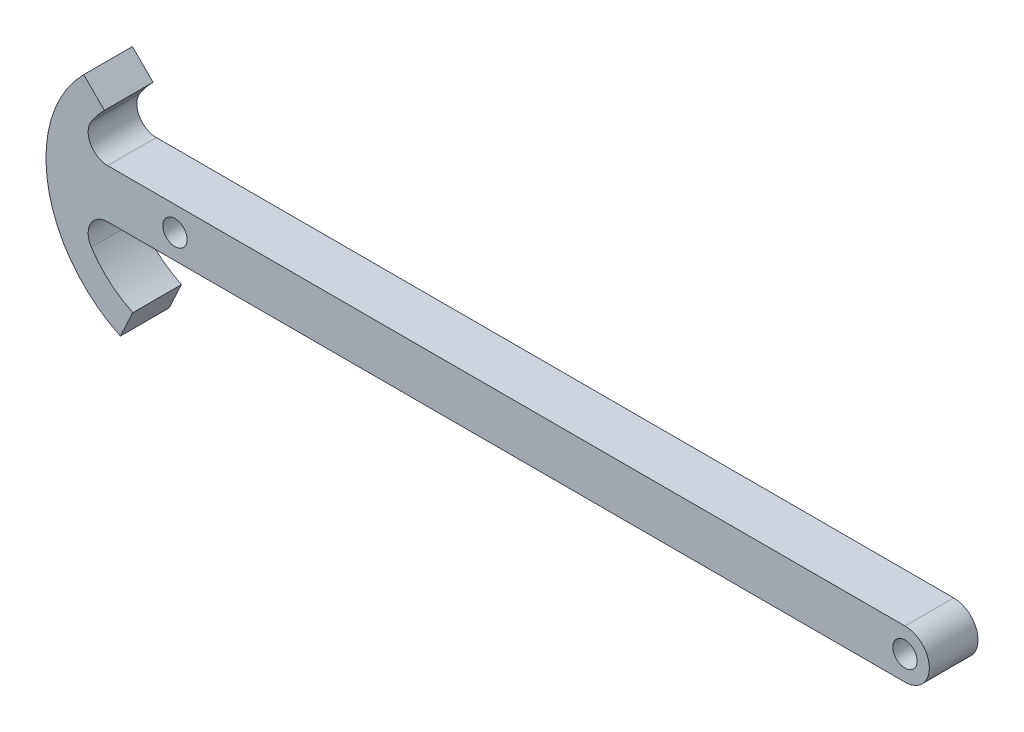
from build123d import *

# Parameters (mm, degrees)
SKETCH1_R                       = 2.5
BOSS_EXTRUDE1_DEPTH             = 5
BOSS_EXTRUDE2_REACH             = 157.161
BOSS_EXTRUDE2_DIRECTION_2_REACH = 157.161
FILLET1_R                       = 4


with BuildPart() as part:
    # Sketch1 → Boss-Extrude1 (new, symmetric)
    with BuildSketch(Plane.XY):
        with BuildLine():
            Line((0, 5), (150, 5))
            ThreePointArc((150, 5), (155, 0), (150, -5))
            Line((150, -5), (0, -5))
            ThreePointArc((0, -5), (-5, 0), (0, 5))
        make_face()
        Circle(SKETCH1_R, mode=Mode.SUBTRACT)
        with Locations((150, 0)):
            Circle(SKETCH1_R, mode=Mode.SUBTRACT)
    extrude(amount=BOSS_EXTRUDE1_DEPTH, both=True)

    # Boss-Extrude2: up to this face of the body (flat: up to its plane)
    boss_extrude2_end = Plane(part.part.faces().sort_by_distance((75, 0, 5))[0])
    # Sketch2 → Boss-Extrude2 (add, up to the picked face)
    with BuildSketch(Plane.XY, mode=Mode.PRIVATE) as boss_extrude2_sk1:
        with BuildLine():
            Line((0, 5), (-19.880895352, 5))
            ThreePointArc((-19.880895352, 5), (-17.831977334, 10.112891988), (-14.495689014, 14.495689014))
            Line((-14.495689014, 14.495689014), (-18.738329701, 18.738329701))
            ThreePointArc((-18.738329701, 18.738329701), (-26.097405455, -4.601676708), (-11.199383936, -24.017156356))
            Line((-11.199383936, -24.017156356), (-8.663674366, -18.579309634))
            ThreePointArc((-8.663674366, -18.579309634), (-15.804984265, -13.055744803), (-19.880895352, -5))
            Line((-19.880895352, -5), (0, -5))
            ThreePointArc((0, -5), (-5, 0), (0, 5))
        make_face()
    boss_extrude2_tool1 = split(extrude(boss_extrude2_sk1.sketch, amount=BOSS_EXTRUDE2_REACH, mode=Mode.PRIVATE), bisect_by=boss_extrude2_end, keep=Keep.BOTH, mode=Mode.PRIVATE)
    add(boss_extrude2_tool1.solids().sort_by(Axis((-16.92377, -2.181901, 0), (0, 0, 1)))[0])

    # Boss-Extrude2 direction 2: up to this face of the body (flat: up to its plane)
    boss_extrude2_direction_2_end = Plane(part.part.faces().sort_by_distance((75, 0, -5))[0])
    # Sketch2 → Boss-Extrude2 direction 2 (add, up to the picked face)
    with BuildSketch(Plane.XY, mode=Mode.PRIVATE) as boss_extrude2_direction_2_sk1:
        with BuildLine():
            Line((0, 5), (-19.880895352, 5))
            ThreePointArc((-19.880895352, 5), (-17.831977334, 10.112891988), (-14.495689014, 14.495689014))
            Line((-14.495689014, 14.495689014), (-18.738329701, 18.738329701))
            ThreePointArc((-18.738329701, 18.738329701), (-26.097405455, -4.601676708), (-11.199383936, -24.017156356))
            Line((-11.199383936, -24.017156356), (-8.663674366, -18.579309634))
            ThreePointArc((-8.663674366, -18.579309634), (-15.804984265, -13.055744803), (-19.880895352, -5))
            Line((-19.880895352, -5), (0, -5))
            ThreePointArc((0, -5), (-5, 0), (0, 5))
        make_face()
    boss_extrude2_direction_2_tool1 = split(extrude(boss_extrude2_direction_2_sk1.sketch, amount=-BOSS_EXTRUDE2_DIRECTION_2_REACH, mode=Mode.PRIVATE), bisect_by=boss_extrude2_direction_2_end, keep=Keep.BOTH, mode=Mode.PRIVATE)
    add(boss_extrude2_direction_2_tool1.solids().sort_by(Axis((-16.92377, -2.181901, 0), (0, 0, -1)))[0])

    # Fillet1
    fillet1_edges = [part.edges().sort_by_distance(p)[0] for p in [
        (-19.880895352, 5, 0),
        (-19.880895352, -5, 0),
    ]]
    fillet(fillet1_edges, radius=FILLET1_R)


solid = part.part
